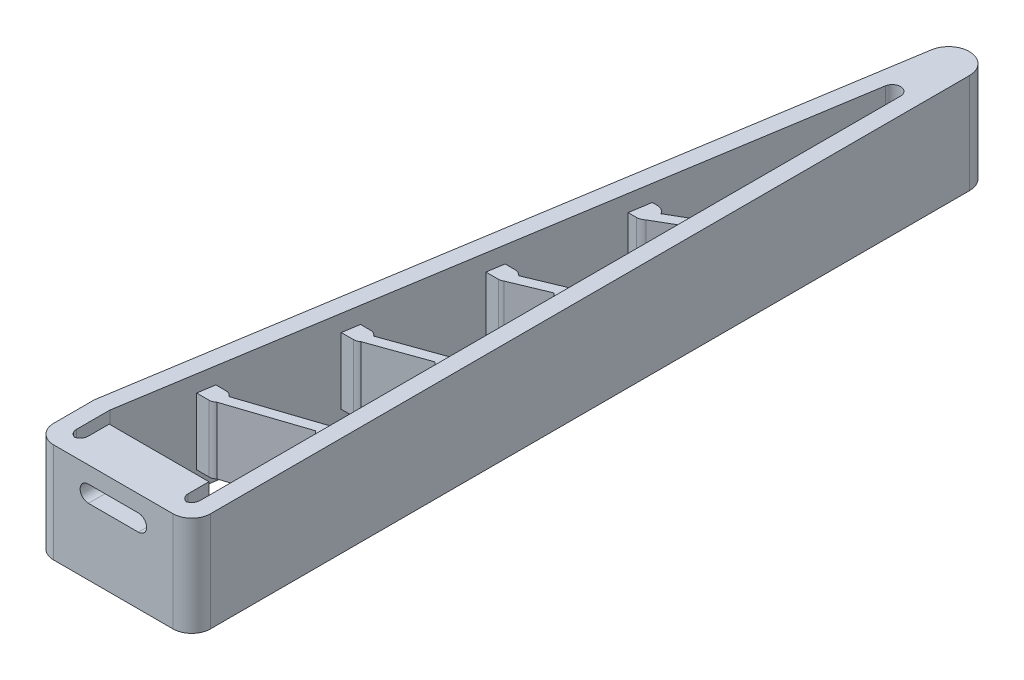
from build123d import *

# Parameters (mm, degrees)
BOSS_EXTRUDE1_DEPTH     = 6
BOSS_EXTRUDE2_DEPTH     = 4
SKETCH6_R               = 0.5
CUT_EXTRUDE1_DEPTH      = 1
FILL_START              = -19.748812638
FILL_PATTERN1_OUTLINE_R = 0.5
FILL_PATTERN1_DEPTH     = 1
FILLET1_R               = 2.25
FILLET2_R               = 1
CUT_EXTRUDE2_DEPTH      = 10


# Read off the part's stored shape, not the designer's step: Fill Pattern1
with BuildPart() as part:
    # Sketch1 → Boss-Extrude1 (new, symmetric)
    with BuildSketch(Plane(origin=(0, 0, 0), x_dir=(1, 0, 0), z_dir=(0, 1, 0))):
        with BuildLine():
            Line((0, 93.551263874), (0, 0))
            Line((0, 0), (-18.854561776, 0))
            Line((-18.854561776, 0), (-18.854561776, 7.158988901))
            Line((-18.854561776, 7.158988901), (-4.96860158, 93.946240126))
            ThreePointArc((-4.96860158, 93.946240126), (-2.301888856, 96.043401906), (0, 93.551263874))
        make_face()
        with BuildLine():
            Line((-16.854561776, 7), (-3.987440632, 87.419507149))
            ThreePointArc((-3.987440632, 87.419507149), (-2.920755543, 88.258371861), (-2, 87.261516648))
            Line((-2, 87.261516648), (-2, 2))
            Line((-2, 2), (-3.427280888, 2))
            Line((-3.427280888, 2), (-3.427280888, 5.5))
            Line((-3.427280888, 5.5), (-15.427280888, 5.5))
            Line((-15.427280888, 5.5), (-15.427280888, 2))
            Line((-15.427280888, 2), (-16.854561776, 2))
            Line((-16.854561776, 2), (-16.854561776, 7))
        make_face(mode=Mode.SUBTRACT)
    extrude(amount=BOSS_EXTRUDE1_DEPTH, both=True)

    # Sketch3 → Boss-Extrude2 (add, symmetric)
    with BuildSketch(Plane(origin=(0, 0, 0), x_dir=(1, 0, 0), z_dir=(0, 1, 0))):
        with BuildLine():
            Line((-2, 20.790573417), (-3.5, 20.790573417))
            ThreePointArc((-3.5, 20.790573417), (-3.859778786, 20.72361105), (-4.171374295, 20.531691867))
            Line((-4.171374295, 20.531691867), (-13.094604983, 17.572425417))
            ThreePointArc((-13.094604983, 17.572425417), (-13.452190397, 17.886686364), (-13.914561776, 18))
            Line((-13.914561776, 18), (-15.094561776, 18))
            Line((-15.094561776, 18), (-15.414561776, 16))
            Line((-15.414561776, 16), (-13.914561776, 16))
            ThreePointArc((-13.914561776, 16), (-13.554782989, 16.066962367), (-13.243187481, 16.25888155))
            Line((-13.243187481, 16.25888155), (-4.319956793, 19.218148001))
            ThreePointArc((-4.319956793, 19.218148001), (-3.962371378, 18.903887053), (-3.5, 18.790573417))
            Line((-3.5, 18.790573417), (-2, 18.790573417))
            Line((-2, 18.790573417), (-2, 20.790573417))
        make_face()
        with BuildLine():
            Line((-13.014561776, 31), (-11.514561776, 31))
            ThreePointArc((-11.514561776, 31), (-11.17076538, 31.060955785), (-10.868881742, 31.236391923))
            Line((-10.868881742, 31.236391923), (-4.319739543, 33.57475887))
            ThreePointArc((-4.319739543, 33.57475887), (-3.962203156, 33.26072129), (-3.5, 33.147495356))
            Line((-3.5, 33.147495356), (-2, 33.147495356))
            Line((-2, 33.147495356), (-2, 35.147495356))
            Line((-2, 35.147495356), (-3.5, 35.147495356))
            ThreePointArc((-3.5, 35.147495356), (-3.839457159, 35.088116872), (-4.138601415, 34.91703303))
            Line((-4.138601415, 34.91703303), (-10.696730072, 32.575457474))
            ThreePointArc((-10.696730072, 32.575457474), (-11.05383272, 32.887540837), (-11.514561776, 33))
            Line((-11.514561776, 33), (-12.694561776, 33))
            Line((-12.694561776, 33), (-13.014561776, 31))
        make_face()
        with BuildLine():
            Line((-2, 47.504417294), (-2, 49.504417294))
            Line((-2, 49.504417294), (-3.5, 49.504417294))
            ThreePointArc((-3.5, 49.504417294), (-3.782156774, 49.463785604), (-4.041384536, 49.345192403))
            Line((-4.041384536, 49.345192403), (-8.295978148, 47.574387364))
            ThreePointArc((-8.295978148, 47.574387364), (-8.653252424, 47.88723936), (-9.114561776, 48))
            Line((-9.114561776, 48), (-10.294561776, 48))
            Line((-10.294561776, 48), (-10.614561776, 46))
            Line((-10.614561776, 46), (-9.114561776, 46))
            ThreePointArc((-9.114561776, 46), (-8.832405002, 46.04063169), (-8.57317724, 46.159224891))
            Line((-8.57317724, 46.159224891), (-4.318583628, 47.93002993))
            ThreePointArc((-4.318583628, 47.93002993), (-3.961309352, 47.617177934), (-3.5, 47.504417294))
            Line((-3.5, 47.504417294), (-2, 47.504417294))
        make_face()
        with BuildLine():
            Line((-2, 61.997186069), (-2, 64.497186069))
            Line((-2, 64.497186069), (-2.6, 64.497186069))
            ThreePointArc((-2.6, 64.497186069), (-3.040392748, 64.417038294), (-3.424311098, 64.186872833))
            Line((-3.424311098, 64.186872833), (-6.159837979, 62.603390263))
            ThreePointArc((-6.159837979, 62.603390263), (-6.618848723, 63.076275483), (-7.254561776, 63.25))
            Line((-7.254561776, 63.25), (-7.854561776, 63.25))
            Line((-7.854561776, 63.25), (-8.254561776, 60.75))
            Line((-8.254561776, 60.75), (-7.254561776, 60.75))
            ThreePointArc((-7.254561776, 60.75), (-6.814169028, 60.830147775), (-6.430250678, 61.060313236))
            Line((-6.430250678, 61.060313236), (-3.694723797, 62.643795806))
            ThreePointArc((-3.694723797, 62.643795806), (-3.235713053, 62.170910586), (-2.6, 61.997186069))
            Line((-2.6, 61.997186069), (-2, 61.997186069))
        make_face()
    extrude(amount=BOSS_EXTRUDE2_DEPTH, both=True)

    # Sketch6 → Cut-Extrude1 (cut)
    with BuildSketch(Plane(origin=(-19.500780031, 0, -3.120124805), x_dir=(-0.15799050110667284, 0, 0.9874406319167055), z_dir=(-0.9874406319167055, 0, -0.15799050110667284))):
        with Locations((-47.590234861, 0)):
            Circle(SKETCH6_R)
    extrude(amount=-CUT_EXTRUDE1_DEPTH, mode=Mode.SUBTRACT)

    # Fill Pattern1 outline → Fill Pattern1 (cut)
    with BuildSketch(Plane(origin=(0, 0, 0), x_dir=(0, 1, 0), z_dir=(0.9874406319167054, 0, 0.1579905011066731)).offset(FILL_START)):
        with Locations((3, -44.590234861)):
            Circle(FILL_PATTERN1_OUTLINE_R)
        with Locations((3, -83.590234861)):
            Circle(FILL_PATTERN1_OUTLINE_R)
        with Locations((3, -8.590234861)):
            Circle(FILL_PATTERN1_OUTLINE_R)
        with Locations((0, -8.590234861)):
            Circle(FILL_PATTERN1_OUTLINE_R)
        with Locations((-3, -8.590234861)):
            Circle(FILL_PATTERN1_OUTLINE_R)
        with Locations((-3, -86.590234861)):
            Circle(FILL_PATTERN1_OUTLINE_R)
        with Locations((0, -86.590234861)):
            Circle(FILL_PATTERN1_OUTLINE_R)
        with Locations((3, -86.590234861)):
            Circle(FILL_PATTERN1_OUTLINE_R)
        with Locations((3, -5.590234861)):
            Circle(FILL_PATTERN1_OUTLINE_R)
        with Locations((-3, -80.590234861)):
            Circle(FILL_PATTERN1_OUTLINE_R)
        with Locations((0, -80.590234861)):
            Circle(FILL_PATTERN1_OUTLINE_R)
        with Locations((3, -80.590234861)):
            Circle(FILL_PATTERN1_OUTLINE_R)
        with Locations((3, -11.590234861)):
            Circle(FILL_PATTERN1_OUTLINE_R)
        with Locations((0, -11.590234861)):
            Circle(FILL_PATTERN1_OUTLINE_R)
        with Locations((-3, -11.590234861)):
            Circle(FILL_PATTERN1_OUTLINE_R)
        with Locations((-3, -83.590234861)):
            Circle(FILL_PATTERN1_OUTLINE_R)
        with Locations((0, -83.590234861)):
            Circle(FILL_PATTERN1_OUTLINE_R)
        with Locations((0, -5.590234861)):
            Circle(FILL_PATTERN1_OUTLINE_R)
        with Locations((-3, -5.590234861)):
            Circle(FILL_PATTERN1_OUTLINE_R)
        with Locations((-3, -89.590234861)):
            Circle(FILL_PATTERN1_OUTLINE_R)
        with Locations((0, -89.590234861)):
            Circle(FILL_PATTERN1_OUTLINE_R)
        with Locations((3, -89.590234861)):
            Circle(FILL_PATTERN1_OUTLINE_R)
        with Locations((0, -59.590234861)):
            Circle(FILL_PATTERN1_OUTLINE_R)
        with Locations((-3, -59.590234861)):
            Circle(FILL_PATTERN1_OUTLINE_R)
        with Locations((-3, -35.590234861)):
            Circle(FILL_PATTERN1_OUTLINE_R)
        with Locations((0, -35.590234861)):
            Circle(FILL_PATTERN1_OUTLINE_R)
        with Locations((3, -35.590234861)):
            Circle(FILL_PATTERN1_OUTLINE_R)
        with Locations((3, -56.590234861)):
            Circle(FILL_PATTERN1_OUTLINE_R)
        with Locations((0, -56.590234861)):
            Circle(FILL_PATTERN1_OUTLINE_R)
        with Locations((-3, -56.590234861)):
            Circle(FILL_PATTERN1_OUTLINE_R)
        with Locations((3, -29.590234861)):
            Circle(FILL_PATTERN1_OUTLINE_R)
        with Locations((3, -62.590234861)):
            Circle(FILL_PATTERN1_OUTLINE_R)
        with Locations((0, -62.590234861)):
            Circle(FILL_PATTERN1_OUTLINE_R)
        with Locations((-3, -62.590234861)):
            Circle(FILL_PATTERN1_OUTLINE_R)
        with Locations((-3, -32.590234861)):
            Circle(FILL_PATTERN1_OUTLINE_R)
        with Locations((0, -32.590234861)):
            Circle(FILL_PATTERN1_OUTLINE_R)
        with Locations((3, -32.590234861)):
            Circle(FILL_PATTERN1_OUTLINE_R)
        with Locations((3, -59.590234861)):
            Circle(FILL_PATTERN1_OUTLINE_R)
        with Locations((3, -41.590234861)):
            Circle(FILL_PATTERN1_OUTLINE_R)
        with Locations((3, -47.590234861)):
            Circle(FILL_PATTERN1_OUTLINE_R)
        with Locations((3, -50.590234861)):
            Circle(FILL_PATTERN1_OUTLINE_R)
        with Locations((0, -50.590234861)):
            Circle(FILL_PATTERN1_OUTLINE_R)
        with Locations((-3, -50.590234861)):
            Circle(FILL_PATTERN1_OUTLINE_R)
        with Locations((-3, -47.590234861)):
            Circle(FILL_PATTERN1_OUTLINE_R)
        with Locations((-3, -44.590234861)):
            Circle(FILL_PATTERN1_OUTLINE_R)
        with Locations((0, -44.590234861)):
            Circle(FILL_PATTERN1_OUTLINE_R)
        with Locations((-3, -38.590234861)):
            Circle(FILL_PATTERN1_OUTLINE_R)
        with Locations((0, -38.590234861)):
            Circle(FILL_PATTERN1_OUTLINE_R)
        with Locations((3, -38.590234861)):
            Circle(FILL_PATTERN1_OUTLINE_R)
        with Locations((3, -53.590234861)):
            Circle(FILL_PATTERN1_OUTLINE_R)
        with Locations((0, -53.590234861)):
            Circle(FILL_PATTERN1_OUTLINE_R)
        with Locations((-3, -53.590234861)):
            Circle(FILL_PATTERN1_OUTLINE_R)
        with Locations((-3, -41.590234861)):
            Circle(FILL_PATTERN1_OUTLINE_R)
        with Locations((0, -41.590234861)):
            Circle(FILL_PATTERN1_OUTLINE_R)
        with Locations((3, -17.590234861)):
            Circle(FILL_PATTERN1_OUTLINE_R)
        with Locations((3, -74.590234861)):
            Circle(FILL_PATTERN1_OUTLINE_R)
        with Locations((0, -74.590234861)):
            Circle(FILL_PATTERN1_OUTLINE_R)
        with Locations((-3, -74.590234861)):
            Circle(FILL_PATTERN1_OUTLINE_R)
        with Locations((-3, -20.590234861)):
            Circle(FILL_PATTERN1_OUTLINE_R)
        with Locations((0, -20.590234861)):
            Circle(FILL_PATTERN1_OUTLINE_R)
        with Locations((3, -20.590234861)):
            Circle(FILL_PATTERN1_OUTLINE_R)
        with Locations((3, -71.590234861)):
            Circle(FILL_PATTERN1_OUTLINE_R)
        with Locations((-3, -14.590234861)):
            Circle(FILL_PATTERN1_OUTLINE_R)
        with Locations((0, -14.590234861)):
            Circle(FILL_PATTERN1_OUTLINE_R)
        with Locations((3, -14.590234861)):
            Circle(FILL_PATTERN1_OUTLINE_R)
        with Locations((3, -77.590234861)):
            Circle(FILL_PATTERN1_OUTLINE_R)
        with Locations((0, -77.590234861)):
            Circle(FILL_PATTERN1_OUTLINE_R)
        with Locations((-3, -77.590234861)):
            Circle(FILL_PATTERN1_OUTLINE_R)
        with Locations((-3, -17.590234861)):
            Circle(FILL_PATTERN1_OUTLINE_R)
        with Locations((0, -17.590234861)):
            Circle(FILL_PATTERN1_OUTLINE_R)
        with Locations((-3, -26.590234861)):
            Circle(FILL_PATTERN1_OUTLINE_R)
        with Locations((0, -26.590234861)):
            Circle(FILL_PATTERN1_OUTLINE_R)
        with Locations((3, -26.590234861)):
            Circle(FILL_PATTERN1_OUTLINE_R)
        with Locations((3, -65.590234861)):
            Circle(FILL_PATTERN1_OUTLINE_R)
        with Locations((0, -65.590234861)):
            Circle(FILL_PATTERN1_OUTLINE_R)
        with Locations((-3, -65.590234861)):
            Circle(FILL_PATTERN1_OUTLINE_R)
        with Locations((-3, -29.590234861)):
            Circle(FILL_PATTERN1_OUTLINE_R)
        with Locations((0, -29.590234861)):
            Circle(FILL_PATTERN1_OUTLINE_R)
        with Locations((0, -71.590234861)):
            Circle(FILL_PATTERN1_OUTLINE_R)
        with Locations((-3, -71.590234861)):
            Circle(FILL_PATTERN1_OUTLINE_R)
        with Locations((-3, -23.590234861)):
            Circle(FILL_PATTERN1_OUTLINE_R)
        with Locations((0, -23.590234861)):
            Circle(FILL_PATTERN1_OUTLINE_R)
        with Locations((3, -23.590234861)):
            Circle(FILL_PATTERN1_OUTLINE_R)
        with Locations((3, -68.590234861)):
            Circle(FILL_PATTERN1_OUTLINE_R)
        with Locations((0, -68.590234861)):
            Circle(FILL_PATTERN1_OUTLINE_R)
        with Locations((-3, -68.590234861)):
            Circle(FILL_PATTERN1_OUTLINE_R)
    extrude(amount=FILL_PATTERN1_DEPTH, mode=Mode.SUBTRACT)

    # Fillet1
    fillet1_edges = [part.edges().sort_by_distance(p)[0] for p in [
        (-18.854561776, 0, 0),
        (-18.854561776, 0, -7.158988901),
        (0, 0, 0),
    ]]
    fillet(fillet1_edges, radius=FILLET1_R)

    # Fillet2
    # the kernel refuses this fillet: 1 mm, written as the material it adds along each edge
    with BuildSketch(Plane(origin=(-3.427280888, 6, -2), x_dir=(0, 0, -1), z_dir=(0, -1, 0)), Plane(origin=(-2, 6, -2), x_dir=(-1, 0, 0), z_dir=(0, -1, 0)), Plane(origin=(-15.427280888, 6, -2), x_dir=(-1, 0, 0), z_dir=(0, -1, 0)), Plane(origin=(-16.854561776, 6, -2), x_dir=(0, 0, -1), z_dir=(0, -1, 0))) as fillet2_piece_1:
        with BuildLine():
            CenterArc((FILLET2_R, FILLET2_R), FILLET2_R, 180, 90)
            Line((0, FILLET2_R), (0, 0))
            Line((0, 0), (FILLET2_R, 0))
        make_face()
    extrude(amount=12)

    # Sketch7 → Cut-Extrude2 (cut)
    with BuildSketch(Plane(origin=(0, 0, -5.5), x_dir=(-1, 0, 0), z_dir=(0, 0, -1))):
        with BuildLine():
            Line((12.427280888, 4), (6.427280888, 4))
            ThreePointArc((6.427280888, 4), (5.427280888, 3), (6.427280888, 2))
            Line((6.427280888, 2), (12.427280888, 2))
            ThreePointArc((12.427280888, 2), (13.427280888, 3), (12.427280888, 4))
        make_face()
    extrude(amount=-CUT_EXTRUDE2_DEPTH, mode=Mode.SUBTRACT)


solid = part.part
